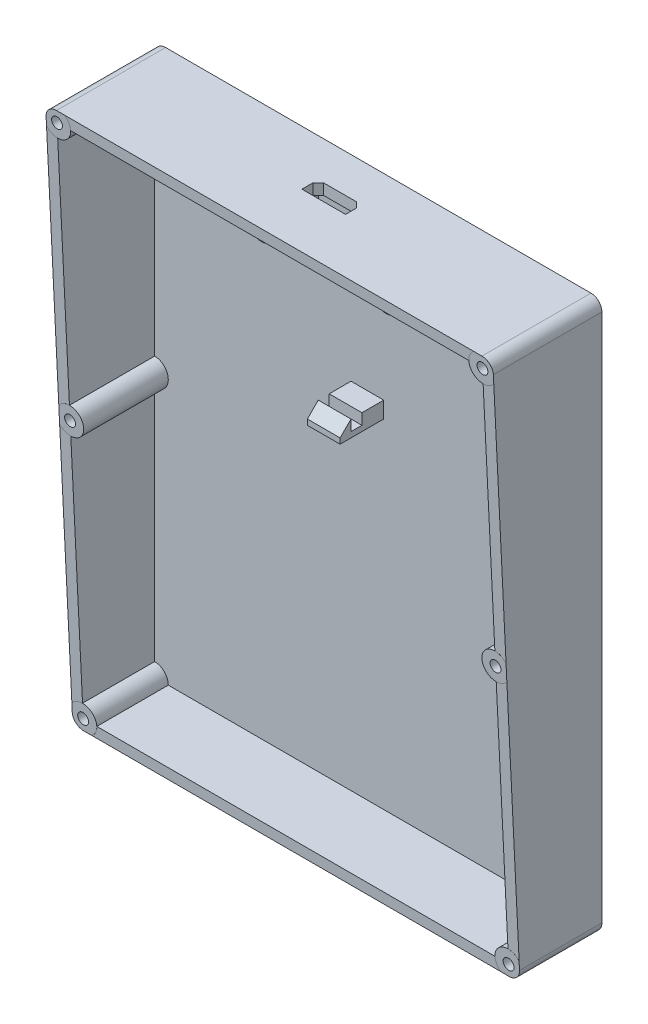
from build123d import *
from build123d.topology import SkipClean

# Parameters (mm, degrees)
BOSS_EXTRU_1_DEPTH      = 20
COQUE1_START            = -48.5
COQUE1_OUTLINE_W        = 78
COQUE1_OUTLINE_H        = 18
COQUE1_DEPTH            = 97
ENL_V_MAT_EXTRU_1_DEPTH = 99.357765326
ESQUISSE3_W             = 3
ESQUISSE3_H             = 5
ESQUISSE3_W_2           = 6
ESQUISSE3_H_2           = 3
BOSS_EXTRU_2_DEPTH      = 8
ESQUISSE4_W             = 1.5
ESQUISSE4_H             = 2
ENL_V_MAT_EXTRU_2_DEPTH = 5
CHANFREIN1_SIZE         = 2
ESQUISSE5_W             = 2
ESQUISSE5_H             = 2
ENL_V_MAT_EXTRU_3_DEPTH = 6
CHANFREIN2_SIZE         = 2
ESQUISSE7_W             = 8
ESQUISSE7_H             = 3
ENL_V_MAT_EXTRU_4_DEPTH = 6
CHANFREIN3_SIZE         = 1
ESQUISSE9_R             = 1
ENL_V_MAT_EXTRU_5_DEPTH = 68.492592186
ESQUISSE10_R            = 1
BOSS_EXTRU_5_DEPTH      = 20
ENL_V_MAT_EXTRU_6_DEPTH = 82


# Read off the part's stored shape, not the designer's step: Coque1
with BuildPart() as part:
    # Esquisse1 → Boss.-Extru.1 (new body)
    with BuildSketch(Plane.XY):
        with BuildLine():
            Line((-39, 50.5), (39, 50.5))
            ThreePointArc((39, 50.5), (40.414213562, 49.914213562), (41, 48.5))
            Line((41, 48.5), (41, -48.5))
            ThreePointArc((41, -48.5), (40.414213562, -49.914213562), (39, -50.5))
            Line((39, -50.5), (-39, -50.5))
            ThreePointArc((-39, -50.5), (-40.414213562, -49.914213562), (-41, -48.5))
            Line((-41, -48.5), (-41, 48.5))
            ThreePointArc((-41, 48.5), (-40.414213562, 49.914213562), (-39, 50.5))
        make_face()
    extrude(amount=BOSS_EXTRU_1_DEPTH)

    # Coque1 outline → Coque1 (cut)
    with BuildSketch(Plane(origin=(0, 0, 0), x_dir=(1, 0, 0), z_dir=(0, 1, 0)).offset(COQUE1_START)):
        with Locations((0, -11)):
            Rectangle(COQUE1_OUTLINE_W, COQUE1_OUTLINE_H)
    extrude(amount=COQUE1_DEPTH, mode=Mode.SUBTRACT)

    # Esquisse2 → Enlèv. mat.-Extru.1 (cut, through all)
    with BuildSketch(Plane.ZY.offset(41)):
        Polygon((20, -50.5), (15, -50.5), (20, 50.5), align=None)
    extrude(amount=-ENL_V_MAT_EXTRU_1_DEPTH, mode=Mode.SUBTRACT)

    # Esquisse3 → Boss.-Extru.2 (add)
    with BuildSketch(Plane.XY.offset(2)):
        with Locations((10.5, 40.982596477)):
            Rectangle(ESQUISSE3_W, ESQUISSE3_H)
        with Locations((-10.5, 40.982596477)):
            Rectangle(ESQUISSE3_W, ESQUISSE3_H)
        with Locations((0, 15.010755302)):
            Rectangle(ESQUISSE3_W_2, ESQUISSE3_H_2)
    extrude(amount=BOSS_EXTRU_2_DEPTH)

    # Esquisse4 → Enlèv. mat.-Extru.2 (cut)
    with BuildSketch(Plane.XZ.offset(-38.482596477)):
        with Locations((9.75, 7)):
            Rectangle(ESQUISSE4_W, ESQUISSE4_H)
        with Locations((-9.75, 7)):
            Rectangle(ESQUISSE4_W, ESQUISSE4_H)
    extrude(amount=-ENL_V_MAT_EXTRU_2_DEPTH, mode=Mode.SUBTRACT)

    # Chanfrein1
    chanfrein1_edges = [part.edges().sort_by_distance(p)[0] for p in [
        (9, 40.982596477, 10),
        (-9, 40.982596477, 10),
    ]]
    chamfer(chanfrein1_edges, length=CHANFREIN1_SIZE - 0.0001)  # a hair under: the kernel refuses the full size

    # Esquisse5 → Enlèv. mat.-Extru.3 (cut)
    with BuildSketch(Plane.ZY.offset(3)):
        with Locations((7, 15.510755302)):
            Rectangle(ESQUISSE5_W, ESQUISSE5_H)
    extrude(amount=-ENL_V_MAT_EXTRU_3_DEPTH, mode=Mode.SUBTRACT)

    # Chanfrein2
    chanfrein2_edges = [part.edges().sort_by_distance(p)[0] for p in [
        (0, 16.510755302, 10),
    ]]
    chamfer(chanfrein2_edges, length=CHANFREIN2_SIZE - 0.0001)  # a hair under: the kernel refuses the full size

    # Esquisse7 → Enlèv. mat.-Extru.4 (cut)
    with BuildSketch(Plane(origin=(0, 50.5, 0), x_dir=(1, 0, 0), z_dir=(0, 1, 0))):
        with Locations((0, -8.5)):
            Rectangle(ESQUISSE7_W, ESQUISSE7_H)
    extrude(amount=-ENL_V_MAT_EXTRU_4_DEPTH, mode=Mode.SUBTRACT)

    # Chanfrein3
    chanfrein3_edges = [part.edges().sort_by_distance(p)[0] for p in [
        (4, 49.5, 7),
        (-4, 49.5, 7),
    ]]
    chamfer(chanfrein3_edges, length=CHANFREIN3_SIZE)

    # Esquisse9 → Enlèv. mat.-Extru.5 (cut, through all)
    with BuildSketch(Plane.XY.offset(2)):
        with Locations((-39, 48.5)):
            Circle(ESQUISSE9_R)
        with Locations((-39, -48.5)):
            Circle(ESQUISSE9_R)
        with Locations((-39, 0)):
            Circle(ESQUISSE9_R)
        with Locations((39, 0)):
            Circle(ESQUISSE9_R)
        with Locations((39, -48.5)):
            Circle(ESQUISSE9_R)
        with Locations((39, 48.5)):
            Circle(ESQUISSE9_R)
    extrude(amount=ENL_V_MAT_EXTRU_5_DEPTH, mode=Mode.SUBTRACT)

    # Esquisse10 → Boss.-Extru.5 (add)
    # profile 1 of 12: a face of its own
    with SkipClean():  # the faces are left unmerged after this step: merging them gives an invalid solid
        with BuildSketch(Plane.XY):
            with BuildLine():
                Line((-41, 48.5), (-41, 47))
                ThreePointArc((-41, 47), (-38.209430585, 46.128291755), (-36.5, 48.5))
                ThreePointArc((-36.5, 48.5), (-36.763932023, 49.618033989), (-37.5, 50.5))
                Line((-37.5, 50.5), (-39, 50.5))
                ThreePointArc((-39, 50.5), (-40.414213562, 49.914213562), (-41, 48.5))
            make_face()
            with Locations((-39, 48.5)):
                Circle(ESQUISSE10_R, mode=Mode.SUBTRACT)
        # profile 2 of 12: a face of its own
        with BuildSketch(Plane.XY):
            with BuildLine():
                Line((39, 50.5), (37.5, 50.5))
                ThreePointArc((37.5, 50.5), (37.232233047, 46.732233047), (41, 47))
                Line((41, 47), (41, 48.5))
                ThreePointArc((41, 48.5), (40.414213562, 49.914213562), (39, 50.5))
            make_face()
            with Locations(Location((39, 48.5, 0), (0, 0, 180))):
                Circle(ESQUISSE10_R, mode=Mode.SUBTRACT)
        # profile 3 of 12: a face of its own
        with BuildSketch(Plane.XY):
            with BuildLine():
                ThreePointArc((-40, 0), (-39, 1), (-38, 0))
                Line((-38, 0), (-36.5, 0))
                ThreePointArc((-36.5, 0), (-38.209430585, 2.371708245), (-41, 1.5))
                Line((-41, 1.5), (-41, 0))
                Line((-41, 0), (-40, 0))
            make_face()
        # profile 4 of 12: a face of its own
        with BuildSketch(Plane.XY):
            with BuildLine():
                Line((-36.5, 0), (-38, 0))
                ThreePointArc((-38, 0), (-39, -1), (-40, 0))
                Line((-40, 0), (-41, 0))
                Line((-41, 0), (-41, -1.5))
                ThreePointArc((-41, -1.5), (-38.209430585, -2.371708245), (-36.5, 0))
            make_face()
        # profile 5 of 12: a face of its own
        with BuildSketch(Plane.XY):
            with BuildLine():
                ThreePointArc((-40, 0), (-39, 1), (-38, 0))
                Line((-38, 0), (-36.5, 0))
                ThreePointArc((-36.5, 0), (-38.209430585, 2.371708245), (-41, 1.5))
                Line((-41, 1.5), (-41, 0))
                Line((-41, 0), (-40, 0))
            make_face()
        # profile 6 of 12: a face of its own
        with BuildSketch(Plane.XY):
            with BuildLine():
                Line((-36.5, 0), (-38, 0))
                ThreePointArc((-38, 0), (-39, -1), (-40, 0))
                Line((-40, 0), (-41, 0))
                Line((-41, 0), (-41, -1.5))
                ThreePointArc((-41, -1.5), (-38.209430585, -2.371708245), (-36.5, 0))
            make_face()
        # profile 7 of 12: a face of its own
        with BuildSketch(Plane.XY):
            with BuildLine():
                ThreePointArc((-36.5, -48.5), (-38.209430585, -46.128291755), (-41, -47))
                Line((-41, -47), (-41, -48.5))
                ThreePointArc((-41, -48.5), (-40.414213562, -49.914213562), (-39, -50.5))
                Line((-39, -50.5), (-37.5, -50.5))
                ThreePointArc((-37.5, -50.5), (-36.763932023, -49.618033989), (-36.5, -48.5))
            make_face()
            with Locations(Location((-39, -48.5, 0), (0, 0, 180))):
                Circle(ESQUISSE10_R, mode=Mode.SUBTRACT)
        # profile 8 of 12: a face of its own
        with BuildSketch(Plane.XY):
            with BuildLine():
                ThreePointArc((41, -47), (37.232233047, -46.732233047), (37.5, -50.5))
                Line((37.5, -50.5), (39, -50.5))
                ThreePointArc((39, -50.5), (40.414213562, -49.914213562), (41, -48.5))
                Line((41, -48.5), (41, -47))
            make_face()
            with Locations((39, -48.5)):
                Circle(ESQUISSE10_R, mode=Mode.SUBTRACT)
        # profile 9 of 12: a face of its own
        with BuildSketch(Plane.XY):
            with BuildLine():
                ThreePointArc((41, 1.5), (38.209430585, 2.371708245), (36.5, 0))
                Line((36.5, 0), (38, 0))
                ThreePointArc((38, 0), (39, 1), (40, 0))
                Line((40, 0), (41, 0))
                Line((41, 0), (41, 1.5))
            make_face()
        # profile 10 of 12: a face of its own
        with BuildSketch(Plane.XY):
            with BuildLine():
                Line((38, 0), (36.5, 0))
                ThreePointArc((36.5, 0), (38.209430585, -2.371708245), (41, -1.5))
                Line((41, -1.5), (41, 0))
                Line((41, 0), (40, 0))
                ThreePointArc((40, 0), (39, -1), (38, 0))
            make_face()
        # profile 11 of 12: a face of its own
        with BuildSketch(Plane.XY):
            with BuildLine():
                ThreePointArc((41, 1.5), (38.209430585, 2.371708245), (36.5, 0))
                Line((36.5, 0), (38, 0))
                ThreePointArc((38, 0), (39, 1), (40, 0))
                Line((40, 0), (41, 0))
                Line((41, 0), (41, 1.5))
            make_face()
        # profile 12 of 12: a face of its own
        with BuildSketch(Plane.XY):
            with BuildLine():
                Line((38, 0), (36.5, 0))
                ThreePointArc((36.5, 0), (38.209430585, -2.371708245), (41, -1.5))
                Line((41, -1.5), (41, 0))
                Line((41, 0), (40, 0))
                ThreePointArc((40, 0), (39, -1), (38, 0))
            make_face()
        extrude(amount=BOSS_EXTRU_5_DEPTH)
    add(part.part.scale(1), mode=Mode.REPLACE)  # the faces are merged on a copy

    # Esquisse11 → Enlèv. mat.-Extru.6 (cut)
    with BuildSketch(Plane(origin=(-41, 0, -41), x_dir=(0, 0, 1), z_dir=(-1, 0, 0))):
        Polygon((61, -50.68921089), (56, -50.68921089), (61, 50.5), align=None)
    extrude(amount=-ENL_V_MAT_EXTRU_6_DEPTH, mode=Mode.SUBTRACT)


solid = part.part
